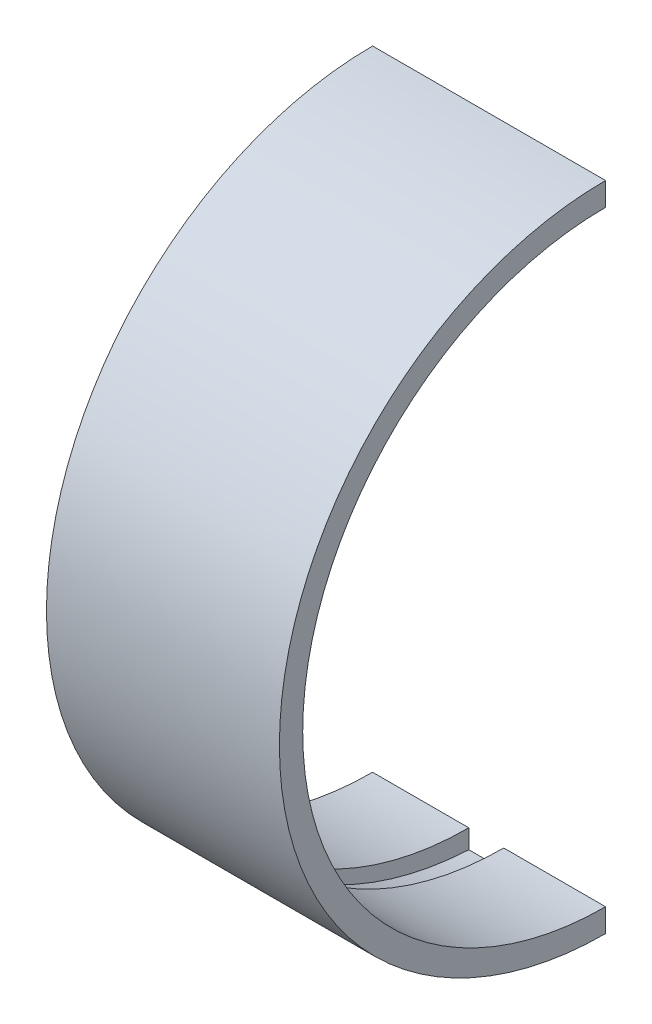
from build123d import *

# Parameters (mm, degrees)
EXTRUDE_THIN1_DEPTH = 508
CAVITY2_START       = 209.868015847
CAVITY2_DEPTH       = 76.2


# Read off the part's stored shape, not the designer's step: Cavity2
with BuildPart() as part:
    # Sketch1 → Extrude-Thin1 (new body)
    with BuildSketch(Plane(origin=(0, 0, 0), x_dir=(0, 0, -1), z_dir=(1, 0, 0))):
        with BuildLine():
            ThreePointArc((0, 660.4), (-660.4, 0), (0, -660.4))
            Line((0, -660.4), (0, -711.2))
            ThreePointArc((0, -711.2), (-711.2, 0), (0, 711.2))
            Line((0, 711.2), (0, 660.4))
        make_face()
    extrude(amount=EXTRUDE_THIN1_DEPTH)

    # Cavity2 outline → Cavity2 (cut)
    with BuildSketch(Plane.YZ.offset(CAVITY2_START)):
        with BuildLine():
            ThreePointArc((706.028233309, 0), (2.092834501, 668.954640909), (-701.842564308, 0))
            Line((-701.842564308, 0), (-660.4, 0))
            ThreePointArc((-660.4, 0), (0, 660.4), (660.4, 0))
            Line((660.4, 0), (706.028233309, 0))
        make_face()
    extrude(amount=CAVITY2_DEPTH, mode=Mode.SUBTRACT)


solid = part.part
